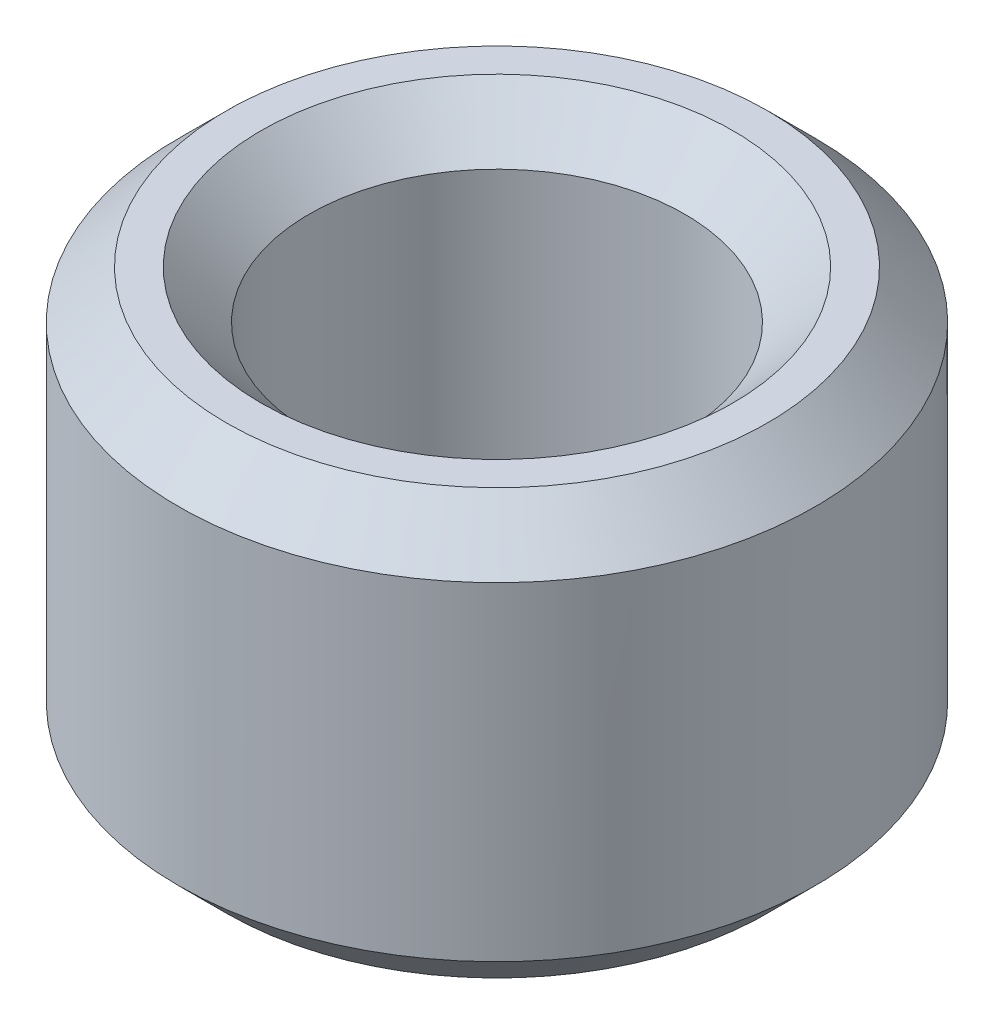
from build123d import *

# Parameters (mm, degrees)
SKETCH1_R           = 12.5
BOSS_EXTRUDE1_DEPTH = 16.655654012
SKETCH2_R           = 7.364663297
CUT_EXTRUDE1_DEPTH  = 25.288079598
CHAMFER1_SIZE       = 1.890259785


with BuildPart() as part:
    # Sketch1 → Boss-Extrude1 (new body)
    with BuildSketch(Plane(origin=(0, 0, 0), x_dir=(1, 0, 0), z_dir=(0, 1, 0))):
        Circle(SKETCH1_R)
    extrude(amount=BOSS_EXTRUDE1_DEPTH)

    # Sketch2 → Cut-Extrude1 (cut, through all)
    with BuildSketch(Plane(origin=(0, 0, 0), x_dir=(1, 0, 0), z_dir=(0, 1, 0))):
        Circle(SKETCH2_R)
    extrude(amount=CUT_EXTRUDE1_DEPTH, mode=Mode.SUBTRACT)

    # Chamfer1
    chamfer1_edges = [part.edges().sort_by_distance(p)[0] for p in [
        (-7.364663297, 16.655654012, 0),
        (-7.364663297, 0, 0),
        (-12.5, 0, 0),
        (-12.5, 16.655654012, 0),
    ]]
    chamfer(chamfer1_edges, length=CHAMFER1_SIZE)


solid = part.part
